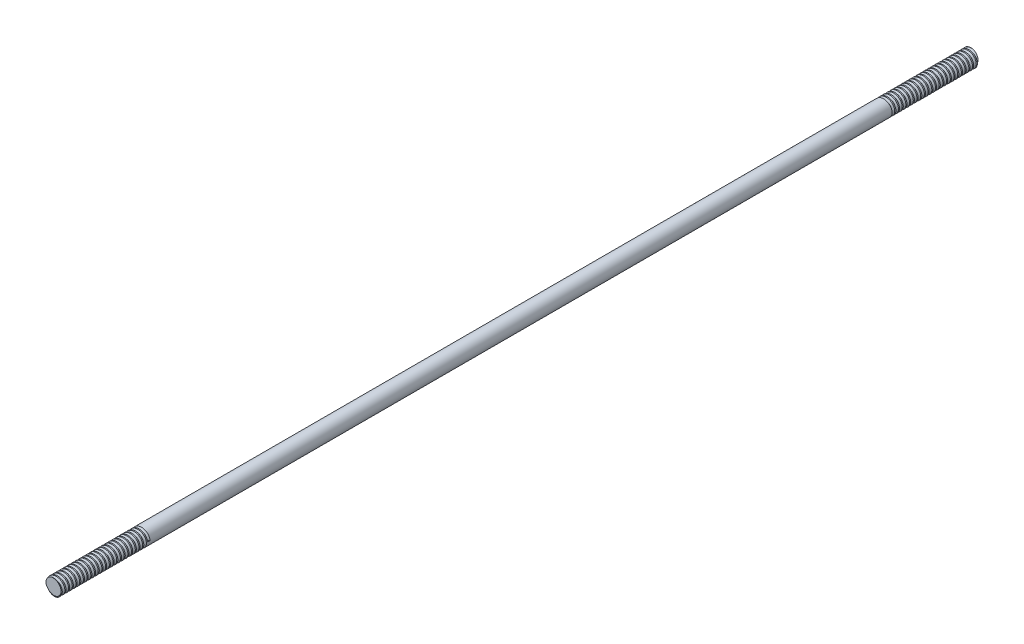
from build123d import *

# Parameters (mm, degrees)
SKETCH1_R      = 1.7526
ROD_DEPTH      = 196.673483906
THREAD_1_PITCH = 0.79375
THREAD_2_PITCH = 0.79375


with BuildPart() as part:
    # Sketch1 → Rod (new body)
    with BuildSketch(Plane.XY):
        Circle(SKETCH1_R)
    extrude(amount=ROD_DEPTH)

    # Thread 1: the profile of Sketch4 profile screwed along a right-hand helix of 24 turns, 8 arcs to a turn; built about Z, then put on its axis
    thread_1_z = Axis((0, 0, 0), (0, 0, 1))
    thread_1_corners = [(1.7529, 0, 0.000173205), (1.7529, 0, -0.555798205), (1.340155401, 0, -0.3175), (1.340155401, 0, -0.238125)]
    with BuildLine(mode=Mode.PRIVATE) as thread_1_profile:
        Line(thread_1_corners[0], thread_1_corners[1])
        Line(thread_1_corners[1], thread_1_corners[2])
        Line(thread_1_corners[2], thread_1_corners[3])
        Line(thread_1_corners[3], thread_1_corners[0])
    thread_1_cap = Face(thread_1_profile.wire())
    thread_1_turn_angles = [0, 22.5, 45, 67.5, 90, 112.5, 135, 157.5, 180, 202.5, 225, 247.5, 270, 292.5, 315, 337.5, 360]
    thread_1_turn_weights = [1, 0.9238795325112867, 1, 0.9238795325112867, 1, 0.9238795325112867, 1, 0.9238795325112867, 1, 0.9238795325112867, 1, 0.9238795325112867, 1, 0.9238795325112867, 1, 0.9238795325112867, 1]
    thread_1_turn_rails = [Edge.make_bspline([Vector(p[0], p[1], 0).rotate(thread_1_z, thread_1_turn_angles[k]) / thread_1_turn_weights[k] + Vector(0, 0, p[2] + THREAD_1_PITCH * thread_1_turn_angles[k] / 360) for k in range(17)], [0, 0, 0, 1, 1, 2, 2, 3, 3, 4, 4, 5, 5, 6, 6, 7, 7, 8, 8, 8], 2, thread_1_turn_weights) for p in thread_1_corners]
    thread_1_turn_sides = [Face.make_surface_from_curves(thread_1_turn_rails[p[0]], thread_1_turn_rails[p[1]]) for p in [(0, 1), (1, 2), (2, 3), (3, 0)]]
    thread_1 = Plane(origin=(0, 0, 0), x_dir=(-1, 0, 0), z_dir=(0, 0, 1)) * Solid(Shell([*[p.moved(Location((0, 0, THREAD_1_PITCH * i))) for i in range(24) for p in thread_1_turn_sides], thread_1_cap, thread_1_cap.rotate(thread_1_z, 8640).moved(Location((0, 0, THREAD_1_PITCH * 8640 / 360)))]))
    add(thread_1, mode=Mode.SUBTRACT)

    # Thread 2: the profile of Sketch6 profile screwed along a right-hand helix of 24 turns, 8 arcs to a turn; built about Z, then put on its axis
    thread_2_z = Axis((0, 0, 0), (0, 0, 1))
    thread_2_corners = [(1.7529, 0, 0.000173205), (1.7529, 0, -0.555798205), (1.340155401, 0, -0.3175), (1.340155401, 0, -0.238125)]
    with BuildLine(mode=Mode.PRIVATE) as thread_2_profile:
        Line(thread_2_corners[0], thread_2_corners[1])
        Line(thread_2_corners[1], thread_2_corners[2])
        Line(thread_2_corners[2], thread_2_corners[3])
        Line(thread_2_corners[3], thread_2_corners[0])
    thread_2_cap = Face(thread_2_profile.wire())
    thread_2_turn_angles = [0, 22.5, 45, 67.5, 90, 112.5, 135, 157.5, 180, 202.5, 225, 247.5, 270, 292.5, 315, 337.5, 360]
    thread_2_turn_weights = [1, 0.9238795325112867, 1, 0.9238795325112867, 1, 0.9238795325112867, 1, 0.9238795325112867, 1, 0.9238795325112867, 1, 0.9238795325112867, 1, 0.9238795325112867, 1, 0.9238795325112867, 1]
    thread_2_turn_rails = [Edge.make_bspline([Vector(p[0], p[1], 0).rotate(thread_2_z, thread_2_turn_angles[k]) / thread_2_turn_weights[k] + Vector(0, 0, p[2] + THREAD_2_PITCH * thread_2_turn_angles[k] / 360) for k in range(17)], [0, 0, 0, 1, 1, 2, 2, 3, 3, 4, 4, 5, 5, 6, 6, 7, 7, 8, 8, 8], 2, thread_2_turn_weights) for p in thread_2_corners]
    thread_2_turn_sides = [Face.make_surface_from_curves(thread_2_turn_rails[p[0]], thread_2_turn_rails[p[1]]) for p in [(0, 1), (1, 2), (2, 3), (3, 0)]]
    thread_2 = Plane(origin=(0, 0, 196.673483906), x_dir=(1, 0, 0), z_dir=(0, 0, -1)) * Solid(Shell([*[p.moved(Location((0, 0, THREAD_2_PITCH * i))) for i in range(24) for p in thread_2_turn_sides], thread_2_cap, thread_2_cap.rotate(thread_2_z, 8640).moved(Location((0, 0, THREAD_2_PITCH * 8640 / 360)))]))
    add(thread_2, mode=Mode.SUBTRACT)


solid = part.part
